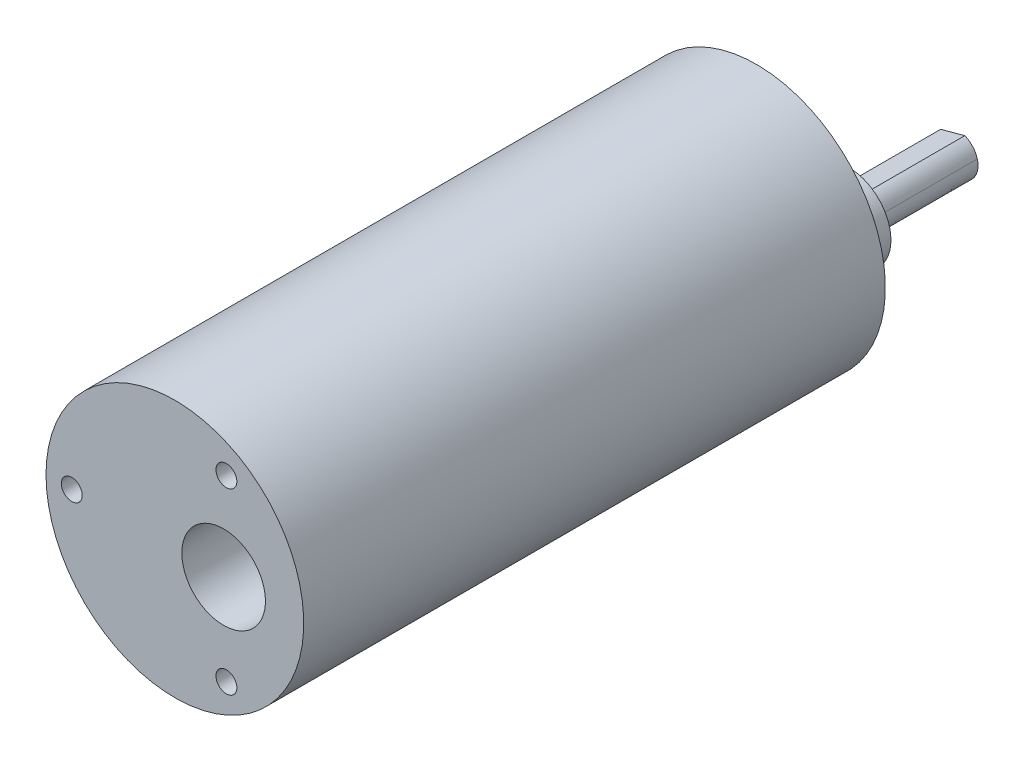
from build123d import *

# Parameters (mm, degrees)
SKETCH1_R           = 1.5
BOSS_EXTRUDE1_DEPTH = 83.5
BOSS_EXTRUDE2_DEPTH = 6.3
BOSS_EXTRUDE3_DEPTH = 21.8


with BuildPart() as part:
    # Sketch1 → Boss-Extrude1 (new body)
    with BuildSketch(Plane.XY):
        with BuildLine():
            ThreePointArc((-18.5, -1e-09), (-1e-09, -18.500000001), (18.5, -4e-09))
            ThreePointArc((18.5, -4e-09), (1e-09, 18.499999998), (-18.5, -1e-09))
        make_face()
        with Locations(Location((7.400368446, -12.817814144, 0), (0, 0, 180))):
            Circle(SKETCH1_R, mode=Mode.SUBTRACT)
        with Locations(Location((-14.800736893, 0, 0), (0, 0, 180))):
            Circle(SKETCH1_R, mode=Mode.SUBTRACT)
        with BuildLine():
            ThreePointArc((13, -1e-09), (7, -6.000000001), (1, 0))
            ThreePointArc((1, 0), (7, 6), (13, -1e-09))
        make_face(mode=Mode.SUBTRACT)
        with Locations(Location((7.400368446, 12.817814144, 0), (0, 0, 180))):
            Circle(SKETCH1_R, mode=Mode.SUBTRACT)
    extrude(amount=BOSS_EXTRUDE1_DEPTH)


with BuildPart() as body_2:
    # Sketch1<4> → Boss-Extrude2 (new body)
    with BuildSketch(Plane.XY):
        with BuildLine():
            ThreePointArc((1, 0), (7, -6.000000001), (13, -1e-09))
            ThreePointArc((13, -1e-09), (7, 6), (1, 0))
        make_face()
        with BuildLine():
            add(Edge.make_bspline(
                [(8.10541894, 2.788921407), (8.05500552, 2.808017036), (7.954470645, 2.846097703), (7.800382794, 2.892843221), (7.644653105, 2.931666611), (7.487006952, 2.961856664), (7.327509508, 2.983596312), (7.060252278, 3.005571873), (6.68327869, 2.996823324), (6.207659642, 2.906637249), (5.752071024, 2.74292972), (5.375767864, 2.533132351), (5.075145817, 2.308378785), (4.837518217, 2.090132072), (4.700743618, 1.92494138), (4.632152753, 1.842100177)],
                knots=[0, 0, 0, 0, 0.041904133, 0.083565582, 0.125104396, 0.166641686, 0.208298579, 0.250195161, 0.375077662, 0.500044869, 0.624999105, 0.749894577, 0.833412578, 0.916458353, 1, 1, 1, 1], degree=3))
            add(Edge.make_bspline(
                [(4.632152753, 1.842100177), (4.597269985, 1.795687752), (4.527611903, 1.703024503), (4.433602806, 1.556735275), (4.347690797, 1.405616278), (4.245209228, 1.197641534), (4.139602727, 0.927062319), (4.05183773, 0.590024289), (4.003020314, 0.245060768), (3.995573118, -0.103006397), (4.02527969, -0.45047126), (4.078837212, -0.676165232), (4.105616921, -0.789016216)],
                knots=[0, 0, 0, 0, 0.062621871, 0.125034978, 0.187450303, 0.250078802, 0.375056772, 0.500052515, 0.625030485, 0.750026228, 0.875008686, 1, 1, 1, 1], degree=3))
            add(Edge.make_bspline(
                [(4.105616921, -0.789016216), (4.121346898, -0.843341546), (4.152683127, -0.95156491), (4.210842998, -1.109818013), (4.276905688, -1.263998492), (4.351672036, -1.413884276), (4.434920833, -1.559525946), (4.526726784, -1.700914361), (4.708992899, -1.950135671), (5.018399378, -2.279613745), (5.50192427, -2.620834329), (6.041515585, -2.864347025), (6.618933709, -2.994641949), (7.210607239, -3.013102901), (7.793942299, -2.912517343), (8.347639904, -2.703148265), (8.848078854, -2.386985144), (9.279508614, -1.981669651), (9.620855698, -1.498035987), (9.864366677, -0.958574348), (9.972979397, -0.476459302), (10.004050984, -0.084821691), (9.997819621, 0.209477257), (9.964166275, 0.502224345), (9.91771995, 0.693107384), (9.894383079, 0.789016217)],
                knots=[0, 0, 0, 0, 0.018019158, 0.035896586, 0.053688522, 0.071452014, 0.089244387, 0.107122684, 0.125143136, 0.187619424, 0.250101049, 0.312577337, 0.375058963, 0.437535251, 0.500016876, 0.562493163, 0.62497479, 0.687451077, 0.749932704, 0.812408993, 0.874890617, 0.906319787, 0.93744398, 0.968568842, 1, 1, 1, 1], degree=3))
            add(Edge.make_bspline(
                [(9.894383079, 0.789016217), (9.87818821, 0.844771359), (9.84585246, 0.956095774), (9.785226535, 1.119076588), (9.715878542, 1.278477594), (9.610987687, 1.485247696), (9.457888215, 1.732080426), (9.240916793, 2.004515242), (8.994236429, 2.250547291), (8.720251014, 2.465345345), (8.42445518, 2.650059005), (8.211765489, 2.742629371), (8.10541894, 2.788921407)],
                knots=[0, 0, 0, 0, 0.06262187, 0.125034977, 0.187450302, 0.250078803, 0.375056772, 0.500052515, 0.625030484, 0.750026228, 0.875008685, 1, 1, 1, 1], degree=3))
        make_face(mode=Mode.SUBTRACT)
    extrude(amount=-BOSS_EXTRUDE2_DEPTH)


with BuildPart() as boss_extrude3_tool:
    # Sketch1<5> → Boss-Extrude3 (new body)
    with BuildSketch(Plane.XY):
        with BuildLine():
            Line((8.105416875, 2.788916194), (4.632157178, 1.842096733))
            add(Edge.make_bspline(
                [(4.632157178, 1.842096733), (4.597269985, 1.795687752), (4.527611903, 1.703024503), (4.433602806, 1.556735275), (4.347690797, 1.405616278), (4.245209228, 1.197641534), (4.139602727, 0.927062319), (4.05183773, 0.590024289), (4.003020314, 0.245060768), (3.995573118, -0.103006397), (4.02527969, -0.45047126), (4.078837212, -0.676165232), (4.105616921, -0.789016216)],
                knots=[0, 0, 0, 0, 0.062621871, 0.125034978, 0.187450303, 0.250078802, 0.375056772, 0.500052515, 0.625030485, 0.750026228, 0.875008686, 1, 1, 1, 1], degree=3))
            add(Edge.make_bspline(
                [(4.105616921, -0.789016216), (4.121346898, -0.843341546), (4.152683127, -0.95156491), (4.210842998, -1.109818013), (4.276905688, -1.263998492), (4.351672036, -1.413884276), (4.434920833, -1.559525946), (4.526726784, -1.700914361), (4.708992899, -1.950135671), (5.018399378, -2.279613745), (5.50192427, -2.620834329), (6.041515585, -2.864347025), (6.618933709, -2.994641949), (7.210607239, -3.013102901), (7.793942299, -2.912517343), (8.347639904, -2.703148265), (8.848078854, -2.386985144), (9.279508614, -1.981669651), (9.620855698, -1.498035987), (9.864366677, -0.958574348), (9.972979397, -0.476459302), (10.004050984, -0.084821691), (9.997819621, 0.209477257), (9.964166275, 0.502224345), (9.91771995, 0.693107384), (9.894383079, 0.789016217)],
                knots=[0, 0, 0, 0, 0.018019158, 0.035896586, 0.053688522, 0.071452014, 0.089244387, 0.107122684, 0.125143136, 0.187619424, 0.250101049, 0.312577337, 0.375058963, 0.437535251, 0.500016876, 0.562493163, 0.62497479, 0.687451077, 0.749932704, 0.812408993, 0.874890617, 0.906319787, 0.93744398, 0.968568842, 1, 1, 1, 1], degree=3))
            add(Edge.make_bspline(
                [(9.894383079, 0.789016217), (9.87818821, 0.844771359), (9.84585246, 0.956095774), (9.785226535, 1.119076588), (9.715878542, 1.278477594), (9.610987687, 1.485247696), (9.457888215, 1.732080426), (9.240916793, 2.004515242), (8.994236429, 2.250547291), (8.720251014, 2.465345345), (8.42445518, 2.650059005), (8.211765489, 2.742629371), (8.105416875, 2.788916194)],
                knots=[0, 0, 0, 0, 0.06262187, 0.125034977, 0.187450302, 0.250078803, 0.375056772, 0.500052515, 0.625030484, 0.750026228, 0.875008685, 1, 1, 1, 1], degree=3))
        make_face()
    extrude(amount=-BOSS_EXTRUDE3_DEPTH)


with BuildPart() as body_2_1:
    add(body_2.part)


with BuildPart() as body_2_2:
    # Boss-Extrude3: joined with boss_extrude3_tool
    add(body_2_1.part.fuse(boss_extrude3_tool.part, tol=0.00001))


solid = Compound([part.part, body_2_2.part])
